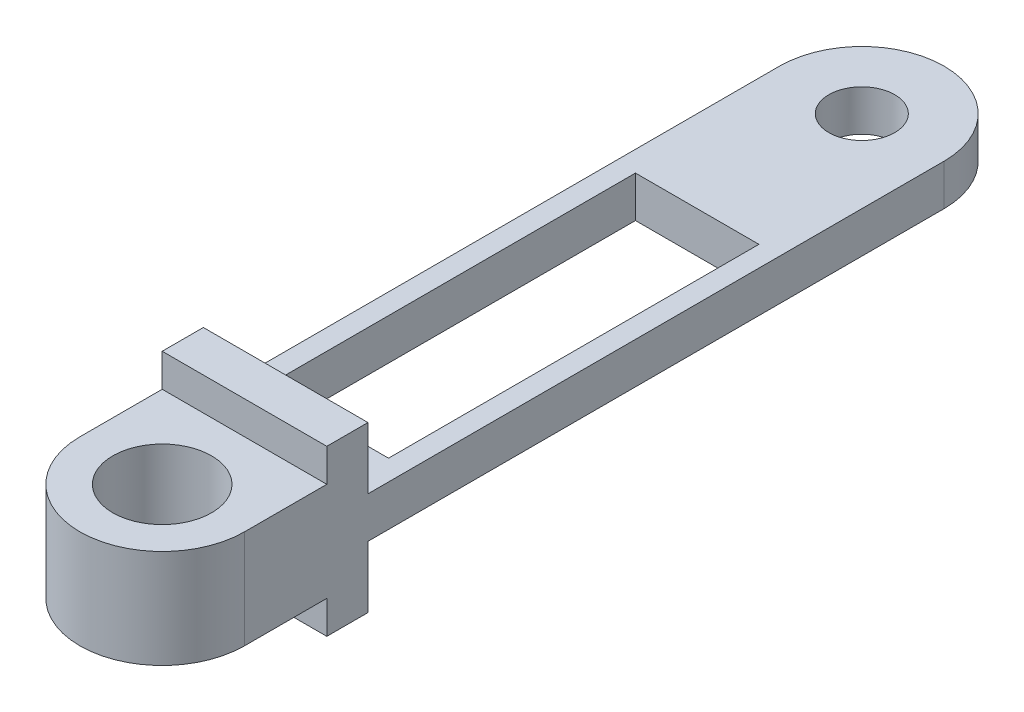
from build123d import *

# Parameters (mm, degrees)
SKETCH_1_W          = 20
SKETCH_1_H          = 20
EXTRUDE_1_DEPTH     = 5
SKETCH_3_W          = 20
SKETCH_3_H          = 80
SKETCH_3_W_2        = 15
SKETCH_3_H_2        = 45
EXTRUDE_2_DEPTH     = 2.5
FILLET_1_R          = 10
SKETCH_5_R          = 4
CUT_EXTRUDE_1_DEPTH = 82.58584436
SKETCH_6_R          = 6
EXTRUDE_3_DEPTH     = 6


with BuildPart() as part:
    # 草图1 → 凸台-拉伸1 (new body)
    with BuildSketch(Plane.XY):
        Rectangle(SKETCH_1_W, SKETCH_1_H)
    extrude(amount=EXTRUDE_1_DEPTH)

    # 草图3 → 凸台-拉伸2 (add, symmetric)
    with BuildSketch(Plane(origin=(0, 0, 0), x_dir=(1, 0, 0), z_dir=(0, 1, 0))):
        with Locations((0, 40)):
            Rectangle(SKETCH_3_W, SKETCH_3_H)
        with Locations((0, 27.5)):
            Rectangle(SKETCH_3_W_2, SKETCH_3_H_2, mode=Mode.SUBTRACT)
    extrude(amount=EXTRUDE_2_DEPTH, both=True)

    # 圆角1
    fillet_1_edges = [part.edges().sort_by_distance(p)[0] for p in [
        (10, 0, -80),
        (-10, 0, -80),
    ]]
    fillet(fillet_1_edges, radius=FILLET_1_R - 0.0001)  # a hair under: the kernel refuses the full size

    # 草图5 → 切除-拉伸1 (cut, through all)
    with BuildSketch(Plane(origin=(0, 2.5, 0), x_dir=(1, 0, 0), z_dir=(0, 1, 0))):
        with Locations(Location((0, 70, 0), (0, 0, 270))):
            Circle(SKETCH_5_R)
    extrude(amount=-CUT_EXTRUDE_1_DEPTH, mode=Mode.SUBTRACT)

    # 草图6 → 凸台-拉伸3 (add, symmetric)
    with BuildSketch(Plane(origin=(0, 0, 0), x_dir=(1, 0, 0), z_dir=(0, 1, 0))):
        with BuildLine():
            Line((-10, -5), (-10, -15))
            ThreePointArc((-10, -15), (0, -25), (10, -15))
            Line((10, -15), (10, -5))
            Line((10, -5), (-10, -5))
        make_face()
        with Locations(Location((0, -15, 0), (0, 0, 270))):
            Circle(SKETCH_6_R, mode=Mode.SUBTRACT)
    extrude(amount=EXTRUDE_3_DEPTH, both=True)


solid = part.part
